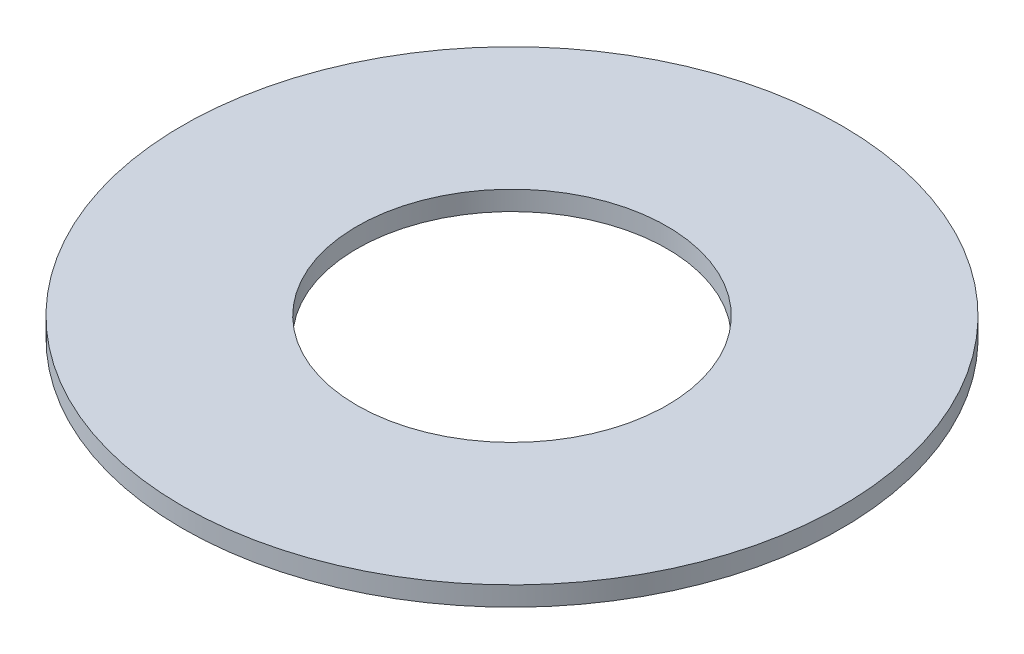
from build123d import *

# Parameters (mm, degrees)
SKETCH1_R           = 85
BOSS_EXTRUDE1_DEPTH = 5
SKETCH2_R           = 40
CUT_EXTRUDE1_DEPTH  = 121.312094155


with BuildPart() as part:
    # Sketch1 → Boss-Extrude1 (new body)
    with BuildSketch(Plane(origin=(0, 0, 0), x_dir=(1, 0, 0), z_dir=(0, 1, 0))):
        Circle(SKETCH1_R)
    extrude(amount=BOSS_EXTRUDE1_DEPTH)

    # Sketch2 → Cut-Extrude1 (cut, through all)
    with BuildSketch(Plane(origin=(0, 0, 0), x_dir=(1, 0, 0), z_dir=(0, 1, 0))):
        Circle(SKETCH2_R)
    extrude(amount=CUT_EXTRUDE1_DEPTH, mode=Mode.SUBTRACT)


solid = part.part
